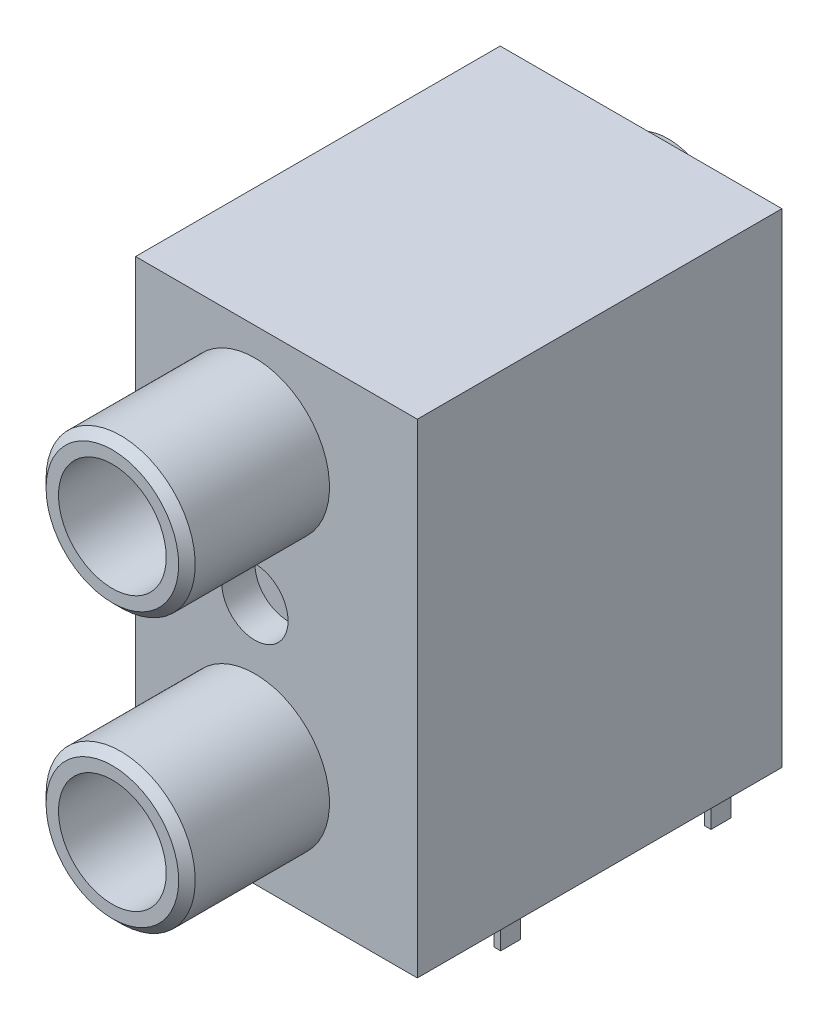
from build123d import *

# Parameters (mm, degrees)
SKETCH1_W                  = 17
SKETCH1_H                  = 22
BOSS_EXTRUDE1_DEPTH        = 29.2
SKETCH3_R                  = 4
BOSS_EXTRUDE2_DEPTH        = 2.94
BOSS_EXTRUDE2_TAPER        = 10
SKETCH4_R                  = 4.5
BOSS_EXTRUDE3_DEPTH        = 8.6
CHAMFER1_SIZE              = 0.5
SKETCH13_R                 = 3.25
CUT_EXTRUDE1_DEPTH         = 29
SKETCH14_W                 = 0.4
SKETCH14_H                 = 1.2
BOSS_EXTRUDE4_DEPTH        = 3.25
LPATTERN1_COUNT            = 2
LPATTERN1_PITCH            = 16.5
CHAMFER1_OF_LPATTERN1_SIZE = 0.5
LPATTERN2_COUNT            = 2
LPATTERN2_PITCH            = 3.17
LPATTERN2_COUNT_DIR2       = 2
LPATTERN2_PITCH_DIR2       = 1.27
SKETCH15_R                 = 2
CUT_EXTRUDE2_DEPTH         = 2


with BuildPart() as part:
    # Sketch1 → Boss-Extrude1 (new body)
    with BuildSketch(Plane(origin=(0, 0, 0), x_dir=(1, 0, 0), z_dir=(0, 1, 0))):
        with Locations((-7.350772662, 1.631732914)):
            Rectangle(SKETCH1_W, SKETCH1_H)
    extrude(amount=BOSS_EXTRUDE1_DEPTH)

    # Sketch3 → Boss-Extrude2 (add)
    with BuildSketch(Plane(origin=(0, 0, -12.631732914), x_dir=(-1, 0, 0), z_dir=(0, 0, -1))):
        with Locations((8.650772662, 6.5)):
            Circle(SKETCH3_R)
    boss_extrude2 = extrude(amount=BOSS_EXTRUDE2_DEPTH, taper=BOSS_EXTRUDE2_TAPER)

    # Sketch4 → Boss-Extrude3 (add)
    with BuildSketch(Plane.XY.offset(9.368267086)):
        with Locations((-8.650772662, 6.5)):
            Circle(SKETCH4_R)
    boss_extrude3 = extrude(amount=BOSS_EXTRUDE3_DEPTH)

    # Chamfer1
    chamfer1_edges = [part.edges().sort_by_distance(p)[0] for p in [
        (-13.150772662, 6.5, 17.968267086),
    ]]
    chamfer(chamfer1_edges, length=CHAMFER1_SIZE)

    # Sketch13 → Cut-Extrude1 (cut)
    with BuildSketch(Plane.XY.offset(17.968267086)):
        with Locations((-8.650772662, 6.5)):
            Circle(SKETCH13_R)
    cut_extrude1 = extrude(amount=-CUT_EXTRUDE1_DEPTH, mode=Mode.SUBTRACT)

    # Sketch14 → Boss-Extrude4 (add)
    with BuildSketch(Plane.XZ):
        with Locations((-13.900772662, 4.758267086)):
            Rectangle(SKETCH14_W, SKETCH14_H)
        with Locations((-2.470772662, 4.758267086)):
            Rectangle(SKETCH14_W, SKETCH14_H)
        with Locations((-2.470772662, -7.931732914)):
            Rectangle(SKETCH14_W, SKETCH14_H)
        with Locations((-13.900772662, -7.931732914)):
            Rectangle(SKETCH14_W, SKETCH14_H)
    boss_extrude4 = extrude(amount=BOSS_EXTRUDE4_DEPTH)

    # LPattern1: Boss-Extrude2, Boss-Extrude3, Cut-Extrude1 ×2
    with Locations(*[(0, i * LPATTERN1_PITCH, 0) for i in range(1, LPATTERN1_COUNT)]):
        add(boss_extrude2)
        add(boss_extrude3)
        add(cut_extrude1, mode=Mode.SUBTRACT)

    # Chamfer1 of LPattern1
    chamfer1_of_lpattern1_edges = [part.edges().sort_by_distance(p)[0] for p in [
        (-13.150772662, 23, 17.968267086),
    ]]
    chamfer(chamfer1_of_lpattern1_edges, length=CHAMFER1_OF_LPATTERN1_SIZE)

    # LPattern2: Boss-Extrude4 2 × 2, 2 skipped
    with Locations(*[(j * LPATTERN2_PITCH_DIR2, 0, -i * LPATTERN2_PITCH) for i in range(LPATTERN2_COUNT) for j in range(LPATTERN2_COUNT_DIR2) if (i, j) not in ((0, 0), (0, 1), (1, 0))]):
        add(boss_extrude4)

    # Sketch15 → Cut-Extrude2 (cut)
    with BuildSketch(Plane.XY.offset(9.368267086)):
        with Locations((-8.650772662, 14.75)):
            Circle(SKETCH15_R)
    extrude(amount=-CUT_EXTRUDE2_DEPTH, mode=Mode.SUBTRACT)


solid = part.part
